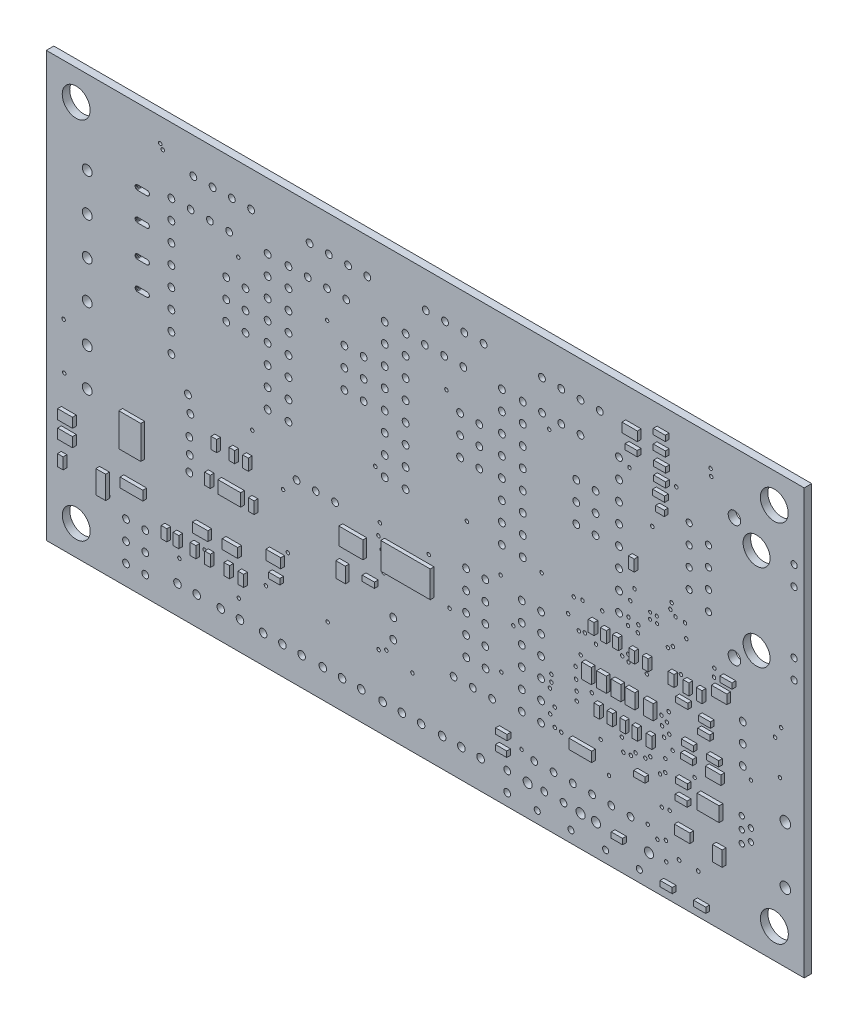
from build123d import *

# Parameters (mm, degrees)
SKETCH1_W           = 100
SKETCH1_H           = 56
SKETCH1_R           = 0.2286
SKETCH1_R_2         = 0.45
SKETCH1_R_3         = 0.2032
SKETCH1_R_4         = 0.4
SKETCH1_R_5         = 0.6
SKETCH1_R_6         = 1.778
SKETCH1_R_7         = 0.4064
SKETCH1_R_8         = 0.8255
SKETCH1_R_9         = 0.4445
SKETCH1_R_10        = 1.8415
SKETCH1_R_11        = 0.5
SKETCH1_R_12        = 0.65
SKETCH1_R_13        = 0.7
SKETCH1_R_14        = 0.35
SKETCH1_R_15        = 0.25
BOSS_EXTRUDE1_DEPTH = 0.991
SKETCH3_W           = 14.03
SKETCH3_H           = 14.03
BOSS_EXTRUDE2_DEPTH = 1.61
CHAMFER1_SIZE       = 0.61
CHAMFER2_SIZE       = 0.61
SKETCH4_W           = 1.304957509
SKETCH4_H           = 3.011808396
SKETCH4_W_2         = 0.747676452
SKETCH4_H_2         = 1.493492764
SKETCH4_W_3         = 1.967512926
SKETCH4_H_3         = 1.275000018
SKETCH4_H_4         = 1.275000015
SKETCH4_W_4         = 3.011798701
SKETCH4_H_5         = 1.246641716
SKETCH4_H_6         = 1.511746408
SKETCH4_W_5         = 0.747676453
SKETCH4_H_7         = 1.511746407
SKETCH4_W_6         = 0.765000025
SKETCH4_W_7         = 0.765000024
SKETCH4_H_8         = 1.493492763
SKETCH4_W_8         = 2.039999962
SKETCH4_H_9         = 1.246482293
SKETCH4_W_9         = 2.039999961
SKETCH4_W_10        = 1.967512925
SKETCH4_W_11        = 1.493492761
SKETCH4_H_10        = 0.74767645
SKETCH4_W_12        = 1.275000015
SKETCH4_H_11        = 2.015661876
SKETCH4_W_13        = 1.60649999
SKETCH4_H_12        = 0.726022008
SKETCH4_W_14        = 3.18
SKETCH4_H_13        = 2.28
SKETCH4_W_15        = 6.527994472
SKETCH4_H_14        = 3.518567085
SKETCH4_H_15        = 0.747676452
SKETCH4_W_16        = 1.511746405
SKETCH4_H_16        = 0.728187441
SKETCH4_W_17        = 1.587333678
SKETCH4_H_17        = 0.728187442
SKETCH4_W_18        = 1.587333679
SKETCH4_H_18        = 1.222102323
SKETCH4_H_19        = 1.222102324
SKETCH4_W_19        = 1.129246393
SKETCH4_H_20        = 0.726022005
SKETCH4_H_21        = 0.73035288
SKETCH4_W_20        = 1.275000018
SKETCH4_H_22        = 1.991323711
SKETCH4_W_21        = 2.91209749
SKETCH4_H_23        = 1.929775795
SKETCH4_W_22        = 1.275000016
SKETCH4_H_24        = 1.967512926
SKETCH4_H_25        = 1.967512925
SKETCH4_W_23        = 3.011808396
SKETCH4_H_26        = 1.304957507
SKETCH4_W_24        = 3.007851747
SKETCH4_H_27        = 1.656233035
SKETCH4_W_25        = 0.765000027
SKETCH4_H_28        = 1.568167369
SKETCH4_W_26        = 2.912100155
SKETCH4_H_29        = 4.346021334
BOSS_EXTRUDE3_DEPTH = 0.5


with BuildPart() as part:
    # Sketch1 → Boss-Extrude1 (new body)
    with BuildSketch(Plane.XY):
        with Locations((13.307133333, 19.688733333)):
            Rectangle(SKETCH1_W, SKETCH1_H)
        with Locations((16.517133333, 10.542066667)):
            Circle(SKETCH1_R, mode=Mode.SUBTRACT)
        with Locations((16.1038, 35.292066667)):
            Circle(SKETCH1_R, mode=Mode.SUBTRACT)
        with Locations((23.247133333, 17.708733333)):
            Circle(SKETCH1_R, mode=Mode.SUBTRACT)
        with Locations((28.654966667, 20.675)):
            Circle(SKETCH1_R, mode=Mode.SUBTRACT)
        with Locations((33.2873, 8.324)):
            Circle(SKETCH1_R, mode=Mode.SUBTRACT)
        with Locations((29.7584, 8.038833333)):
            Circle(SKETCH1_R, mode=Mode.SUBTRACT)
        with Locations((7.324866667, 15.717566667)):
            Circle(SKETCH1_R, mode=Mode.SUBTRACT)
        with Locations((0.357133333, 35.348733333)):
            Circle(SKETCH1_R, mode=Mode.SUBTRACT)
        with Locations((18.7985, 21.621333333)):
            Circle(SKETCH1_R, mode=Mode.SUBTRACT)
        with Locations((29.953666667, 9.716366667)):
            Circle(SKETCH1_R, mode=Mode.SUBTRACT)
        with Locations((29.957133333, 8.818733333)):
            Circle(SKETCH1_R, mode=Mode.SUBTRACT)
        with Locations((13.775033333, 15.313666667)):
            Circle(SKETCH1_R, mode=Mode.SUBTRACT)
        with Locations((-11.3662, 36.7154)):
            Circle(SKETCH1_R, mode=Mode.SUBTRACT)
        with Locations((-9.514866667, 17.868733333)):
            Circle(SKETCH1_R, mode=Mode.SUBTRACT)
        with Locations((31.240733333, 3.7565)):
            Circle(SKETCH1_R, mode=Mode.SUBTRACT)
        with Locations((23.347133333, 6.668733333)):
            Circle(SKETCH1_R, mode=Mode.SUBTRACT)
        with Locations((-4.822866667, 6.2254)):
            Circle(SKETCH1_R, mode=Mode.SUBTRACT)
        with Locations((-5.455866667, 13.126533333)):
            Circle(SKETCH1_R, mode=Mode.SUBTRACT)
        with Locations((44.280266667, 5.492133333)):
            Circle(SKETCH1_R, mode=Mode.SUBTRACT)
        with Locations((44.978, 6.005366667)):
            Circle(SKETCH1_R, mode=Mode.SUBTRACT)
        with Locations((44.4754, 12.311333333)):
            Circle(SKETCH1_R, mode=Mode.SUBTRACT)
        with Locations((43.267133333, 33.278733333)):
            Circle(SKETCH1_R, mode=Mode.SUBTRACT)
        with Locations((42.6598, -1.0665)):
            Circle(SKETCH1_R, mode=Mode.SUBTRACT)
        with Locations((34.367133333, 16.658733333)):
            Circle(SKETCH1_R, mode=Mode.SUBTRACT)
        with Locations((60.109233333, 12.993033333)):
            Circle(SKETCH1_R, mode=Mode.SUBTRACT)
        with Locations((34.054133333, 20.227433333)):
            Circle(SKETCH1_R, mode=Mode.SUBTRACT)
        with Locations((32.895666667, 20.0402)):
            Circle(SKETCH1_R, mode=Mode.SUBTRACT)
        with Locations((59.464766667, 17.276366667)):
            Circle(SKETCH1_R, mode=Mode.SUBTRACT)
        with Locations((35.836333333, 16.1019)):
            Circle(SKETCH1_R, mode=Mode.SUBTRACT)
        with Locations((45.058033333, -1.707333333)):
            Circle(SKETCH1_R, mode=Mode.SUBTRACT)
        with Locations((45.196033333, 11.876533333)):
            Circle(SKETCH1_R, mode=Mode.SUBTRACT)
        with Locations((45.497133333, 10.638733333)):
            Circle(SKETCH1_R, mode=Mode.SUBTRACT)
        with Locations((47.577133333, 24.406633333)):
            Circle(SKETCH1_R, mode=Mode.SUBTRACT)
        with Locations((45.942433333, 9.0166)):
            Circle(SKETCH1_R, mode=Mode.SUBTRACT)
        with Locations((7.1314, 14.127733333)):
            Circle(SKETCH1_R, mode=Mode.SUBTRACT)
        with Locations((8.1788, 1.5814)):
            Circle(SKETCH1_R, mode=Mode.SUBTRACT)
        with Locations((7.150466667, 1.132433333)):
            Circle(SKETCH1_R, mode=Mode.SUBTRACT)
        with Locations((7.560233333, 12.723533333)):
            Circle(SKETCH1_R, mode=Mode.SUBTRACT)
        with Locations((33.570733333, 16.4904)):
            Circle(SKETCH1_R, mode=Mode.SUBTRACT)
        with Locations((30.405466667, 3.868966667)):
            Circle(SKETCH1_R, mode=Mode.SUBTRACT)
        with Locations((33.817133333, 13.858733333)):
            Circle(SKETCH1_R, mode=Mode.SUBTRACT)
        with Locations((45.554133333, 1.960466667)):
            Circle(SKETCH1_R, mode=Mode.SUBTRACT)
        with Locations((44.522833333, 1.823566667)):
            Circle(SKETCH1_R, mode=Mode.SUBTRACT)
        with Locations((29.78, 5.116033333)):
            Circle(SKETCH1_R, mode=Mode.SUBTRACT)
        with Locations((35.280466667, 10.2754)):
            Circle(SKETCH1_R, mode=Mode.SUBTRACT)
        with Locations((33.137266667, 12.216166667)):
            Circle(SKETCH1_R, mode=Mode.SUBTRACT)
        with Locations((24.935866667, 12.76)):
            Circle(SKETCH1_R, mode=Mode.SUBTRACT)
        with Locations((44.9896, 7.609033333)):
            Circle(SKETCH1_R, mode=Mode.SUBTRACT)
        with Locations((36.447133333, 5.518733333)):
            Circle(SKETCH1_R, mode=Mode.SUBTRACT)
        with Locations((48.840466667, 7.3754)):
            Circle(SKETCH1_R, mode=Mode.SUBTRACT)
        with Locations((39.448433333, 5.549133333)):
            Circle(SKETCH1_R, mode=Mode.SUBTRACT)
        with Locations((40.437133333, 5.692066667)):
            Circle(SKETCH1_R, mode=Mode.SUBTRACT)
        with Locations((33.274433333, 9.458733333)):
            Circle(SKETCH1_R, mode=Mode.SUBTRACT)
        with Locations((33.2072, 10.780633333)):
            Circle(SKETCH1_R, mode=Mode.SUBTRACT)
        with Locations((-19.129533333, -1.5746)):
            Circle(SKETCH1_R, mode=Mode.SUBTRACT)
        with Locations((45.4266, 13.179366667)):
            Circle(SKETCH1_R, mode=Mode.SUBTRACT)
        with Locations((11.617133333, 0.7045)):
            Circle(SKETCH1_R, mode=Mode.SUBTRACT)
        with Locations((41.427133333, 21.1092)):
            Circle(SKETCH1_R, mode=Mode.SUBTRACT)
        with Locations((47.747133333, 22.678733333)):
            Circle(SKETCH1_R, mode=Mode.SUBTRACT)
        with Locations((40.917133333, 24.978733333)):
            Circle(SKETCH1_R, mode=Mode.SUBTRACT)
        with Locations((41.361033333, 20.165566667)):
            Circle(SKETCH1_R, mode=Mode.SUBTRACT)
        with Locations((46.427133333, 39.368733333)):
            Circle(SKETCH1_R, mode=Mode.SUBTRACT)
        with Locations((40.2556, 38.4838)):
            Circle(SKETCH1_R, mode=Mode.SUBTRACT)
        with Locations((40.357133333, 23.338733333)):
            Circle(SKETCH1_R, mode=Mode.SUBTRACT)
        with Locations((41.054133333, 6.2989)):
            Circle(SKETCH1_R, mode=Mode.SUBTRACT)
        with Locations((39.253133333, 7.182733333)):
            Circle(SKETCH1_R, mode=Mode.SUBTRACT)
        with Locations((42.338833333, 6.328733333)):
            Circle(SKETCH1_R, mode=Mode.SUBTRACT)
        with Locations((42.9945, 6.828033333)):
            Circle(SKETCH1_R, mode=Mode.SUBTRACT)
        with Locations((30.386433333, 6.186533333)):
            Circle(SKETCH1_R, mode=Mode.SUBTRACT)
        with Locations((-34.406866667, 18.111466667)):
            Circle(SKETCH1_R, mode=Mode.SUBTRACT)
        with Locations((-28.5043, 0.940866667)):
            Circle(SKETCH1_R, mode=Mode.SUBTRACT)
        with Locations((26.011566667, -0.8344)):
            Circle(SKETCH1_R, mode=Mode.SUBTRACT)
        with Locations((7.8107, 10.236633333)):
            Circle(SKETCH1_R, mode=Mode.SUBTRACT)
        with Locations((29.667133333, 37.558733333)):
            Circle(SKETCH1_R, mode=Mode.SUBTRACT)
        with Locations((45.657133333, 24.988733333)):
            Circle(SKETCH1_R, mode=Mode.SUBTRACT)
        with Locations((46.327133333, 24.488733333)):
            Circle(SKETCH1_R, mode=Mode.SUBTRACT)
        with Locations((45.807133333, 25.828733333)):
            Circle(SKETCH1_R, mode=Mode.SUBTRACT)
        with Locations((40.091166667, 17.0729)):
            Circle(SKETCH1_R, mode=Mode.SUBTRACT)
        with Locations((40.123066667, 16.205066667)):
            Circle(SKETCH1_R, mode=Mode.SUBTRACT)
        with Locations((40.120466667, 21.342066667)):
            Circle(SKETCH1_R, mode=Mode.SUBTRACT)
        with Locations((47.047133333, 18.238733333)):
            Circle(SKETCH1_R, mode=Mode.SUBTRACT)
        with Locations((51.4538, 21.1754)):
            Circle(SKETCH1_R, mode=Mode.SUBTRACT)
        with Locations((40.060466667, 20.342066667)):
            Circle(SKETCH1_R, mode=Mode.SUBTRACT)
        with Locations((36.657133333, 20.318733333)):
            Circle(SKETCH1_R, mode=Mode.SUBTRACT)
        with Locations((45.325533333, 20.4579)):
            Circle(SKETCH1_R, mode=Mode.SUBTRACT)
        with Locations((39.297133333, 16.488733333)):
            Circle(SKETCH1_R, mode=Mode.SUBTRACT)
        with Locations((45.987133333, 20.918733333)):
            Circle(SKETCH1_R, mode=Mode.SUBTRACT)
        with Locations((42.541533333, 16.037033333)):
            Circle(SKETCH1_R, mode=Mode.SUBTRACT)
        with Locations((-11.2929, -2.2113)):
            Circle(SKETCH1_R, mode=Mode.SUBTRACT)
        with Locations((32.157133333, 17.748733333)):
            Circle(SKETCH1_R, mode=Mode.SUBTRACT)
        with Locations((-15.7962, 1.048733333)):
            Circle(SKETCH1_R, mode=Mode.SUBTRACT)
        with Locations((45.107133333, -4.131266667)):
            Circle(SKETCH1_R, mode=Mode.SUBTRACT)
        with Locations((44.814766667, 9.958733333)):
            Circle(SKETCH1_R, mode=Mode.SUBTRACT)
        with Locations((0.4297, 0.934466667)):
            Circle(SKETCH1_R, mode=Mode.SUBTRACT)
        with Locations((43.940133333, -2.1493)):
            Circle(SKETCH1_R, mode=Mode.SUBTRACT)
        with Locations((51.4038, 20.1054)):
            Circle(SKETCH1_R, mode=Mode.SUBTRACT)
        with Locations((56.2838, 10.788733333)):
            Circle(SKETCH1_R, mode=Mode.SUBTRACT)
        with Locations((60.252366667, 18.778733333)):
            Circle(SKETCH1_R, mode=Mode.SUBTRACT)
        with Locations((44.5511, 11.129766667)):
            Circle(SKETCH1_R, mode=Mode.SUBTRACT)
        with Locations((-7.712866667, 1.008733333)):
            Circle(SKETCH1_R, mode=Mode.SUBTRACT)
        with Locations((6.717133333, 21.8554)):
            Circle(SKETCH1_R, mode=Mode.SUBTRACT)
        with Locations((37.554133333, 1.958466667)):
            Circle(SKETCH1_R, mode=Mode.SUBTRACT)
        with Locations((51.046, 42.863433333)):
            Circle(SKETCH1_R, mode=Mode.SUBTRACT)
        with Locations((50.954666667, 43.742866667)):
            Circle(SKETCH1_R, mode=Mode.SUBTRACT)
        with Locations((-21.327033333, 44.012166667)):
            Circle(SKETCH1_R, mode=Mode.SUBTRACT)
        with Locations((-21.664366667, 44.555966667)):
            Circle(SKETCH1_R, mode=Mode.SUBTRACT)
        with Locations((-34.329733333, 12.002933333)):
            Circle(SKETCH1_R, mode=Mode.SUBTRACT)
        with Locations((-9.669533333, 43.021366667)):
            Circle(SKETCH1_R_2, mode=Mode.SUBTRACT)
        with Locations((-12.209533333, 43.021366667)):
            Circle(SKETCH1_R_2, mode=Mode.SUBTRACT)
        with Locations((-14.749533333, 43.016733333)):
            Circle(SKETCH1_R_2, mode=Mode.SUBTRACT)
        with Locations((-17.289533333, 43.012066667)):
            Circle(SKETCH1_R_2, mode=Mode.SUBTRACT)
        with Locations((5.667133333, 43.031366667)):
            Circle(SKETCH1_R_2, mode=Mode.SUBTRACT)
        with Locations((3.127133333, 43.031366667)):
            Circle(SKETCH1_R_2, mode=Mode.SUBTRACT)
        with Locations((0.587133333, 43.026733333)):
            Circle(SKETCH1_R_2, mode=Mode.SUBTRACT)
        with Locations((-1.952866667, 43.022066667)):
            Circle(SKETCH1_R_2, mode=Mode.SUBTRACT)
        with Locations((21.0038, 43.021366667)):
            Circle(SKETCH1_R_2, mode=Mode.SUBTRACT)
        with Locations((18.4638, 43.021366667)):
            Circle(SKETCH1_R_2, mode=Mode.SUBTRACT)
        with Locations((15.9238, 43.016733333)):
            Circle(SKETCH1_R_2, mode=Mode.SUBTRACT)
        with Locations((13.3838, 43.012066667)):
            Circle(SKETCH1_R_2, mode=Mode.SUBTRACT)
        with Locations((36.3338, 43.001366667)):
            Circle(SKETCH1_R_2, mode=Mode.SUBTRACT)
        with Locations((33.7938, 43.001366667)):
            Circle(SKETCH1_R_2, mode=Mode.SUBTRACT)
        with Locations((31.2538, 42.996733333)):
            Circle(SKETCH1_R_2, mode=Mode.SUBTRACT)
        with Locations((28.7138, 42.992066667)):
            Circle(SKETCH1_R_2, mode=Mode.SUBTRACT)
        with Locations((42.977133333, 22.508733333)):
            Circle(SKETCH1_R_3, mode=Mode.SUBTRACT)
        with Locations((43.888866667, 22.474)):
            Circle(SKETCH1_R_3, mode=Mode.SUBTRACT)
        with Locations((43.854133333, 23.324933333)):
            Circle(SKETCH1_R_3, mode=Mode.SUBTRACT)
        with Locations((42.985833333, 23.324933333)):
            Circle(SKETCH1_R_3, mode=Mode.SUBTRACT)
        with Locations((32.531166667, -6.787266667)):
            Circle(SKETCH1_R_4, mode=Mode.SUBTRACT)
        with Locations((28.086166667, -6.787266667)):
            Circle(SKETCH1_R_4, mode=Mode.SUBTRACT)
        with Locations((33.801166667, -4.247266667)):
            Circle(SKETCH1_R_5, mode=Mode.SUBTRACT)
        with Locations((26.816166667, -4.247266667)):
            Circle(SKETCH1_R_5, mode=Mode.SUBTRACT)
        with Locations((57.024133333, 37.387733333)):
            Circle(SKETCH1_R_6, mode=Mode.SUBTRACT)
        with Locations((57.024133333, 25.957733333)):
            Circle(SKETCH1_R_6, mode=Mode.SUBTRACT)
        with Locations((61.977133333, 35.736733333)):
            Circle(SKETCH1_R_7, mode=Mode.SUBTRACT)
        with Locations((61.977133333, 38.276733333)):
            Circle(SKETCH1_R_7, mode=Mode.SUBTRACT)
        with Locations((48.134133333, 28.497733333)):
            Circle(SKETCH1_R_7, mode=Mode.SUBTRACT)
        with Locations((50.674133333, 27.227733333)):
            Circle(SKETCH1_R_7, mode=Mode.SUBTRACT)
        with Locations((54.103133333, 23.671733333)):
            Circle(SKETCH1_R_8, mode=Mode.SUBTRACT)
        with Locations((54.103133333, 39.673733333)):
            Circle(SKETCH1_R_8, mode=Mode.SUBTRACT)
        with Locations((48.134133333, 33.577733333)):
            Circle(SKETCH1_R_7, mode=Mode.SUBTRACT)
        with Locations((50.674133333, 29.767733333)):
            Circle(SKETCH1_R_7, mode=Mode.SUBTRACT)
        with Locations((50.674133333, 32.307733333)):
            Circle(SKETCH1_R_7, mode=Mode.SUBTRACT)
        with Locations((48.134133333, 31.037733333)):
            Circle(SKETCH1_R_7, mode=Mode.SUBTRACT)
        with Locations((50.674133333, 34.847733333)):
            Circle(SKETCH1_R_7, mode=Mode.SUBTRACT)
        with Locations((48.134133333, 36.117733333)):
            Circle(SKETCH1_R_7, mode=Mode.SUBTRACT)
        with Locations((61.977133333, 27.608733333)):
            Circle(SKETCH1_R_7, mode=Mode.SUBTRACT)
        with Locations((61.977133333, 25.068733333)):
            Circle(SKETCH1_R_7, mode=Mode.SUBTRACT)
        with Locations((9.088633333, 3.244966667)):
            Circle(SKETCH1_R_9, mode=Mode.SUBTRACT)
        with Locations((9.088633333, 5.784966667)):
            Circle(SKETCH1_R_9, mode=Mode.SUBTRACT)
        with Locations((21.269933333, 6.039733333)):
            Circle(SKETCH1_R_9, mode=Mode.SUBTRACT)
        with Locations((18.729933333, 6.039733333)):
            Circle(SKETCH1_R_9, mode=Mode.SUBTRACT)
        with Locations((41.5524, -6.778766667)):
            Circle(SKETCH1_R_4, mode=Mode.SUBTRACT)
        with Locations((37.1074, -6.778766667)):
            Circle(SKETCH1_R_4, mode=Mode.SUBTRACT)
        with Locations((42.8224, -4.238766667)):
            Circle(SKETCH1_R_5, mode=Mode.SUBTRACT)
        with Locations((35.8374, -4.238766667)):
            Circle(SKETCH1_R_5, mode=Mode.SUBTRACT)
        with Locations((59.3696, -4.380766667)):
            Circle(SKETCH1_R_10, mode=Mode.SUBTRACT)
        with Locations((59.360433333, 43.742233333)):
            Circle(SKETCH1_R_10, mode=Mode.SUBTRACT)
        with Locations((-32.7488, 43.734533333)):
            Circle(SKETCH1_R_10, mode=Mode.SUBTRACT)
        with Locations((-32.740366667, -4.374766667)):
            Circle(SKETCH1_R_10, mode=Mode.SUBTRACT)
        with Locations((-17.819533333, 12.9654)):
            Circle(SKETCH1_R_2, mode=Mode.SUBTRACT)
        with Locations((-17.818433333, 8.893166667)):
            Circle(SKETCH1_R_2, mode=Mode.SUBTRACT)
        with Locations((-17.762866667, 10.928733333)):
            Circle(SKETCH1_R_2, mode=Mode.SUBTRACT)
        with Locations((-17.682066667, 15.652966667)):
            Circle(SKETCH1_R_2, mode=Mode.SUBTRACT)
        with Locations((-18.002866667, 17.718733333)):
            Circle(SKETCH1_R_2, mode=Mode.SUBTRACT)
        with Locations((33.7912, 38.9854)):
            Circle(SKETCH1_R_9, mode=Mode.SUBTRACT)
        with Locations((31.2512, 38.9854)):
            Circle(SKETCH1_R_9, mode=Mode.SUBTRACT)
        with Locations((28.7112, 38.9854)):
            Circle(SKETCH1_R_9, mode=Mode.SUBTRACT)
        with Locations((26.1712, 21.2054)):
            Circle(SKETCH1_R_2, mode=Mode.SUBTRACT)
        with Locations((26.1712, 36.4454)):
            Circle(SKETCH1_R_2, mode=Mode.SUBTRACT)
        with Locations((38.8712, 36.4454)):
            Circle(SKETCH1_R_2, mode=Mode.SUBTRACT)
        with Locations((38.8712, 33.9054)):
            Circle(SKETCH1_R_2, mode=Mode.SUBTRACT)
        with Locations((38.8712, 31.3654)):
            Circle(SKETCH1_R_2, mode=Mode.SUBTRACT)
        with Locations((38.8712, 28.8254)):
            Circle(SKETCH1_R_2, mode=Mode.SUBTRACT)
        with Locations((38.8712, 26.2854)):
            Circle(SKETCH1_R_2, mode=Mode.SUBTRACT)
        with Locations((38.8712, 23.7454)):
            Circle(SKETCH1_R_2, mode=Mode.SUBTRACT)
        with Locations((26.1712, 23.7454)):
            Circle(SKETCH1_R_2, mode=Mode.SUBTRACT)
        with Locations((26.1712, 38.9854)):
            Circle(SKETCH1_R_2, mode=Mode.SUBTRACT)
        with Locations((38.8712, 21.2054)):
            Circle(SKETCH1_R_2, mode=Mode.SUBTRACT)
        with Locations((38.8712, 38.9854)):
            Circle(SKETCH1_R_2, mode=Mode.SUBTRACT)
        with Locations((26.1712, 26.2854)):
            Circle(SKETCH1_R_2, mode=Mode.SUBTRACT)
        with Locations((26.1712, 28.8254)):
            Circle(SKETCH1_R_2, mode=Mode.SUBTRACT)
        with Locations((26.1712, 33.9054)):
            Circle(SKETCH1_R_2, mode=Mode.SUBTRACT)
        with Locations((26.1712, 31.3654)):
            Circle(SKETCH1_R_2, mode=Mode.SUBTRACT)
        with Locations((18.337133333, 39.0254)):
            Circle(SKETCH1_R_9, mode=Mode.SUBTRACT)
        with Locations((15.797133333, 39.0254)):
            Circle(SKETCH1_R_9, mode=Mode.SUBTRACT)
        with Locations((13.257133333, 39.0254)):
            Circle(SKETCH1_R_9, mode=Mode.SUBTRACT)
        with Locations((10.717133333, 21.2454)):
            Circle(SKETCH1_R_2, mode=Mode.SUBTRACT)
        with Locations((10.717133333, 36.4854)):
            Circle(SKETCH1_R_2, mode=Mode.SUBTRACT)
        with Locations((23.417133333, 36.4854)):
            Circle(SKETCH1_R_2, mode=Mode.SUBTRACT)
        with Locations((23.417133333, 33.9454)):
            Circle(SKETCH1_R_2, mode=Mode.SUBTRACT)
        with Locations((23.417133333, 31.4054)):
            Circle(SKETCH1_R_2, mode=Mode.SUBTRACT)
        with Locations((23.417133333, 28.8654)):
            Circle(SKETCH1_R_2, mode=Mode.SUBTRACT)
        with Locations((23.417133333, 26.3254)):
            Circle(SKETCH1_R_2, mode=Mode.SUBTRACT)
        with Locations((23.417133333, 23.7854)):
            Circle(SKETCH1_R_2, mode=Mode.SUBTRACT)
        with Locations((10.717133333, 23.7854)):
            Circle(SKETCH1_R_2, mode=Mode.SUBTRACT)
        with Locations((10.717133333, 39.0254)):
            Circle(SKETCH1_R_2, mode=Mode.SUBTRACT)
        with Locations((23.417133333, 21.2454)):
            Circle(SKETCH1_R_2, mode=Mode.SUBTRACT)
        with Locations((23.417133333, 39.0254)):
            Circle(SKETCH1_R_2, mode=Mode.SUBTRACT)
        with Locations((10.717133333, 26.3254)):
            Circle(SKETCH1_R_2, mode=Mode.SUBTRACT)
        with Locations((10.717133333, 28.8654)):
            Circle(SKETCH1_R_2, mode=Mode.SUBTRACT)
        with Locations((10.717133333, 33.9454)):
            Circle(SKETCH1_R_2, mode=Mode.SUBTRACT)
        with Locations((10.717133333, 31.4054)):
            Circle(SKETCH1_R_2, mode=Mode.SUBTRACT)
        with Locations((2.8838, 39.0154)):
            Circle(SKETCH1_R_9, mode=Mode.SUBTRACT)
        with Locations((0.3438, 39.0154)):
            Circle(SKETCH1_R_9, mode=Mode.SUBTRACT)
        with Locations((-2.1962, 39.0154)):
            Circle(SKETCH1_R_9, mode=Mode.SUBTRACT)
        with Locations((-4.7362, 21.2354)):
            Circle(SKETCH1_R_2, mode=Mode.SUBTRACT)
        with Locations((-4.7362, 36.4754)):
            Circle(SKETCH1_R_2, mode=Mode.SUBTRACT)
        with Locations((7.9638, 36.4754)):
            Circle(SKETCH1_R_2, mode=Mode.SUBTRACT)
        with Locations((7.9638, 33.9354)):
            Circle(SKETCH1_R_2, mode=Mode.SUBTRACT)
        with Locations((7.9638, 31.3954)):
            Circle(SKETCH1_R_2, mode=Mode.SUBTRACT)
        with Locations((7.9638, 28.8554)):
            Circle(SKETCH1_R_2, mode=Mode.SUBTRACT)
        with Locations((7.9638, 26.3154)):
            Circle(SKETCH1_R_2, mode=Mode.SUBTRACT)
        with Locations((7.9638, 23.7754)):
            Circle(SKETCH1_R_2, mode=Mode.SUBTRACT)
        with Locations((-4.7362, 23.7754)):
            Circle(SKETCH1_R_2, mode=Mode.SUBTRACT)
        with Locations((-4.7362, 39.0154)):
            Circle(SKETCH1_R_2, mode=Mode.SUBTRACT)
        with Locations((7.9638, 21.2354)):
            Circle(SKETCH1_R_2, mode=Mode.SUBTRACT)
        with Locations((7.9638, 39.0154)):
            Circle(SKETCH1_R_2, mode=Mode.SUBTRACT)
        with Locations((-4.7362, 26.3154)):
            Circle(SKETCH1_R_2, mode=Mode.SUBTRACT)
        with Locations((-4.7362, 28.8554)):
            Circle(SKETCH1_R_2, mode=Mode.SUBTRACT)
        with Locations((-4.7362, 33.9354)):
            Circle(SKETCH1_R_2, mode=Mode.SUBTRACT)
        with Locations((-4.7362, 31.3954)):
            Circle(SKETCH1_R_2, mode=Mode.SUBTRACT)
        with Locations((-12.569533333, 39.0254)):
            Circle(SKETCH1_R_9, mode=Mode.SUBTRACT)
        with Locations((-15.109533333, 39.0254)):
            Circle(SKETCH1_R_9, mode=Mode.SUBTRACT)
        with Locations((-17.649533333, 39.0254)):
            Circle(SKETCH1_R_9, mode=Mode.SUBTRACT)
        with Locations((-20.189533333, 21.2454)):
            Circle(SKETCH1_R_2, mode=Mode.SUBTRACT)
        with Locations((-20.189533333, 36.4854)):
            Circle(SKETCH1_R_2, mode=Mode.SUBTRACT)
        with Locations((-7.489533333, 36.4854)):
            Circle(SKETCH1_R_2, mode=Mode.SUBTRACT)
        with Locations((-7.489533333, 33.9454)):
            Circle(SKETCH1_R_2, mode=Mode.SUBTRACT)
        with Locations((-7.489533333, 31.4054)):
            Circle(SKETCH1_R_2, mode=Mode.SUBTRACT)
        with Locations((-7.489533333, 28.8654)):
            Circle(SKETCH1_R_2, mode=Mode.SUBTRACT)
        with Locations((-7.489533333, 26.3254)):
            Circle(SKETCH1_R_2, mode=Mode.SUBTRACT)
        with Locations((-7.489533333, 23.7854)):
            Circle(SKETCH1_R_2, mode=Mode.SUBTRACT)
        with Locations((-20.189533333, 23.7854)):
            Circle(SKETCH1_R_2, mode=Mode.SUBTRACT)
        with Locations((-20.189533333, 39.0254)):
            Circle(SKETCH1_R_2, mode=Mode.SUBTRACT)
        with Locations((-7.489533333, 21.2454)):
            Circle(SKETCH1_R_2, mode=Mode.SUBTRACT)
        with Locations((-7.489533333, 39.0254)):
            Circle(SKETCH1_R_2, mode=Mode.SUBTRACT)
        with Locations((-20.189533333, 26.3254)):
            Circle(SKETCH1_R_2, mode=Mode.SUBTRACT)
        with Locations((-20.189533333, 28.8654)):
            Circle(SKETCH1_R_2, mode=Mode.SUBTRACT)
        with Locations((-20.189533333, 33.9454)):
            Circle(SKETCH1_R_2, mode=Mode.SUBTRACT)
        with Locations((-20.189533333, 31.4054)):
            Circle(SKETCH1_R_2, mode=Mode.SUBTRACT)
        with Locations((55.197133333, 16.9454)):
            Circle(SKETCH1_R_9, mode=Mode.SUBTRACT)
        with Locations((55.197133333, 14.4054)):
            Circle(SKETCH1_R_9, mode=Mode.SUBTRACT)
        with Locations((55.197133333, 11.8654)):
            Circle(SKETCH1_R_9, mode=Mode.SUBTRACT)
        with Locations((-13.6768, -4.579166667)):
            Circle(SKETCH1_R_11, mode=Mode.SUBTRACT)
        with Locations((-11.1368, -4.5745)):
            Circle(SKETCH1_R_11, mode=Mode.SUBTRACT)
        with Locations((-19.384666667, -4.579166667)):
            Circle(SKETCH1_R_11, mode=Mode.SUBTRACT)
        with Locations((-16.844666667, -4.5745)):
            Circle(SKETCH1_R_11, mode=Mode.SUBTRACT)
        with Locations((-3.672866667, 15.0986)):
            Circle(SKETCH1_R_9, mode=Mode.SUBTRACT)
        with Locations((-1.132866667, 15.0986)):
            Circle(SKETCH1_R_9, mode=Mode.SUBTRACT)
        with Locations((1.407133333, 15.0986)):
            Circle(SKETCH1_R_9, mode=Mode.SUBTRACT)
        with Locations((22.125833333, 3.001733333)):
            Circle(SKETCH1_R_9, mode=Mode.SUBTRACT)
        with Locations((19.585833333, 3.001733333)):
            Circle(SKETCH1_R_9, mode=Mode.SUBTRACT)
        with Locations((17.045833333, 3.001733333)):
            Circle(SKETCH1_R_9, mode=Mode.SUBTRACT)
        with Locations((15.531666667, -4.549433333)):
            Circle(SKETCH1_R_11, mode=Mode.SUBTRACT)
        with Locations((18.071666667, -4.5448)):
            Circle(SKETCH1_R_11, mode=Mode.SUBTRACT)
        with Locations((20.6117, -4.540133333)):
            Circle(SKETCH1_R_11, mode=Mode.SUBTRACT)
        with Locations((7.678066667, -4.549433333)):
            Circle(SKETCH1_R_11, mode=Mode.SUBTRACT)
        with Locations((10.218066667, -4.5448)):
            Circle(SKETCH1_R_11, mode=Mode.SUBTRACT)
        with Locations((12.7581, -4.540133333)):
            Circle(SKETCH1_R_11, mode=Mode.SUBTRACT)
        with Locations((-0.2119, -4.549433333)):
            Circle(SKETCH1_R_11, mode=Mode.SUBTRACT)
        with Locations((2.3281, -4.5448)):
            Circle(SKETCH1_R_11, mode=Mode.SUBTRACT)
        with Locations((4.868133333, -4.540133333)):
            Circle(SKETCH1_R_11, mode=Mode.SUBTRACT)
        with Locations((-8.0837, -4.585833333)):
            Circle(SKETCH1_R_11, mode=Mode.SUBTRACT)
        with Locations((-5.5437, -4.5812)):
            Circle(SKETCH1_R_11, mode=Mode.SUBTRACT)
        with Locations((-3.003666667, -4.576533333)):
            Circle(SKETCH1_R_11, mode=Mode.SUBTRACT)
        with Locations((-12.9462, 28.562066667)):
            Circle(SKETCH1_R_9, mode=Mode.SUBTRACT)
        with Locations((-12.9462, 31.102066667)):
            Circle(SKETCH1_R_9, mode=Mode.SUBTRACT)
        with Locations((-12.9462, 33.642066667)):
            Circle(SKETCH1_R_9, mode=Mode.SUBTRACT)
        with Locations((-10.4062, 28.562066667)):
            Circle(SKETCH1_R_9, mode=Mode.SUBTRACT)
        with Locations((-10.4062, 31.102066667)):
            Circle(SKETCH1_R_9, mode=Mode.SUBTRACT)
        with Locations((-10.4062, 33.642066667)):
            Circle(SKETCH1_R_9, mode=Mode.SUBTRACT)
        with Locations((2.640466667, 28.5454)):
            Circle(SKETCH1_R_9, mode=Mode.SUBTRACT)
        with Locations((2.640466667, 31.0854)):
            Circle(SKETCH1_R_9, mode=Mode.SUBTRACT)
        with Locations((2.640466667, 33.6254)):
            Circle(SKETCH1_R_9, mode=Mode.SUBTRACT)
        with Locations((5.180466667, 28.5454)):
            Circle(SKETCH1_R_9, mode=Mode.SUBTRACT)
        with Locations((5.180466667, 31.0854)):
            Circle(SKETCH1_R_9, mode=Mode.SUBTRACT)
        with Locations((5.180466667, 33.6254)):
            Circle(SKETCH1_R_9, mode=Mode.SUBTRACT)
        with Locations((17.899733333, 28.467933333)):
            Circle(SKETCH1_R_9, mode=Mode.SUBTRACT)
        with Locations((17.899733333, 31.007933333)):
            Circle(SKETCH1_R_9, mode=Mode.SUBTRACT)
        with Locations((17.899733333, 33.547933333)):
            Circle(SKETCH1_R_9, mode=Mode.SUBTRACT)
        with Locations((20.439733333, 28.467933333)):
            Circle(SKETCH1_R_9, mode=Mode.SUBTRACT)
        with Locations((20.439733333, 31.007933333)):
            Circle(SKETCH1_R_9, mode=Mode.SUBTRACT)
        with Locations((20.439733333, 33.547933333)):
            Circle(SKETCH1_R_9, mode=Mode.SUBTRACT)
        with Locations((33.238933333, 28.508733333)):
            Circle(SKETCH1_R_9, mode=Mode.SUBTRACT)
        with Locations((33.238933333, 31.048733333)):
            Circle(SKETCH1_R_9, mode=Mode.SUBTRACT)
        with Locations((33.238933333, 33.588733333)):
            Circle(SKETCH1_R_9, mode=Mode.SUBTRACT)
        with Locations((35.778933333, 28.508733333)):
            Circle(SKETCH1_R_9, mode=Mode.SUBTRACT)
        with Locations((35.778933333, 31.048733333)):
            Circle(SKETCH1_R_9, mode=Mode.SUBTRACT)
        with Locations((35.778933333, 33.588733333)):
            Circle(SKETCH1_R_9, mode=Mode.SUBTRACT)
        with Locations((24.1205, -6.733933333)):
            Circle(SKETCH1_R_9, mode=Mode.SUBTRACT)
        with Locations((24.1205, -4.193933333)):
            Circle(SKETCH1_R_9, mode=Mode.SUBTRACT)
        with Locations((27.696133333, -1.326266667)):
            Circle(SKETCH1_R_9, mode=Mode.SUBTRACT)
        with Locations((30.236133333, -1.326266667)):
            Circle(SKETCH1_R_9, mode=Mode.SUBTRACT)
        with Locations((32.776133333, -1.326266667)):
            Circle(SKETCH1_R_9, mode=Mode.SUBTRACT)
        with Locations((35.316133333, -1.326266667)):
            Circle(SKETCH1_R_9, mode=Mode.SUBTRACT)
        with Locations((37.856133333, -1.326266667)):
            Circle(SKETCH1_R_9, mode=Mode.SUBTRACT)
        with Locations((40.396133333, -1.326266667)):
            Circle(SKETCH1_R_9, mode=Mode.SUBTRACT)
        with Locations((-31.292866667, 11.688733333)):
            Circle(SKETCH1_R_12, mode=Mode.SUBTRACT)
        with Locations((-31.292866667, 16.688733333)):
            Circle(SKETCH1_R_12, mode=Mode.SUBTRACT)
        with Locations((-31.292866667, 21.688733333)):
            Circle(SKETCH1_R_12, mode=Mode.SUBTRACT)
        with Locations((-31.292866667, 26.688733333)):
            Circle(SKETCH1_R_12, mode=Mode.SUBTRACT)
        with Locations((-31.292866667, 31.688733333)):
            Circle(SKETCH1_R_12, mode=Mode.SUBTRACT)
        with Locations((-31.292866667, 36.688733333)):
            Circle(SKETCH1_R_12, mode=Mode.SUBTRACT)
        with Locations((60.8153, 8.2611)):
            Circle(SKETCH1_R_13, mode=Mode.SUBTRACT)
        with Locations((60.8153, 0.756366667)):
            Circle(SKETCH1_R_13, mode=Mode.SUBTRACT)
        with Locations((56.267133333, 5.308733333)):
            Circle(SKETCH1_R_14, mode=Mode.SUBTRACT)
        with Locations((56.267133333, 3.708733333)):
            Circle(SKETCH1_R_14, mode=Mode.SUBTRACT)
        with Locations((55.067133333, 6.108733333)):
            Circle(SKETCH1_R_14, mode=Mode.SUBTRACT)
        with Locations((55.067133333, 2.908733333)):
            Circle(SKETCH1_R_14, mode=Mode.SUBTRACT)
        with Locations((55.067133333, 4.508733333)):
            Circle(SKETCH1_R_14, mode=Mode.SUBTRACT)
        with Locations((28.585133333, 16.199733333)):
            Circle(SKETCH1_R_9, mode=Mode.SUBTRACT)
        with Locations((28.585133333, 13.659733333)):
            Circle(SKETCH1_R_9, mode=Mode.SUBTRACT)
        with Locations((28.585133333, 11.119733333)):
            Circle(SKETCH1_R_9, mode=Mode.SUBTRACT)
        with Locations((26.045133333, 16.199733333)):
            Circle(SKETCH1_R_9, mode=Mode.SUBTRACT)
        with Locations((26.045133333, 13.659733333)):
            Circle(SKETCH1_R_9, mode=Mode.SUBTRACT)
        with Locations((26.045133333, 11.119733333)):
            Circle(SKETCH1_R_9, mode=Mode.SUBTRACT)
        with Locations((-23.6384, -0.606133333)):
            Circle(SKETCH1_R_9, mode=Mode.SUBTRACT)
        with Locations((-23.6384, -3.146133333)):
            Circle(SKETCH1_R_9, mode=Mode.SUBTRACT)
        with Locations((-23.6384, -5.686133333)):
            Circle(SKETCH1_R_9, mode=Mode.SUBTRACT)
        with Locations((-26.1784, -0.606133333)):
            Circle(SKETCH1_R_9, mode=Mode.SUBTRACT)
        with Locations((-26.1784, -3.146133333)):
            Circle(SKETCH1_R_9, mode=Mode.SUBTRACT)
        with Locations((-26.1784, -5.686133333)):
            Circle(SKETCH1_R_9, mode=Mode.SUBTRACT)
        with Locations((28.585133333, 8.579733333)):
            Circle(SKETCH1_R_9, mode=Mode.SUBTRACT)
        with Locations((28.585133333, 6.039733333)):
            Circle(SKETCH1_R_9, mode=Mode.SUBTRACT)
        with Locations((28.585133333, 3.499733333)):
            Circle(SKETCH1_R_9, mode=Mode.SUBTRACT)
        with Locations((26.045133333, 8.579733333)):
            Circle(SKETCH1_R_9, mode=Mode.SUBTRACT)
        with Locations((26.045133333, 6.039733333)):
            Circle(SKETCH1_R_9, mode=Mode.SUBTRACT)
        with Locations((26.045133333, 3.499733333)):
            Circle(SKETCH1_R_9, mode=Mode.SUBTRACT)
        with Locations((18.694866667, 11.117866667)):
            Circle(SKETCH1_R_9, mode=Mode.SUBTRACT)
        with Locations((18.694866667, 13.657866667)):
            Circle(SKETCH1_R_9, mode=Mode.SUBTRACT)
        with Locations((18.694866667, 16.197866667)):
            Circle(SKETCH1_R_9, mode=Mode.SUBTRACT)
        with Locations((21.234866667, 11.117866667)):
            Circle(SKETCH1_R_9, mode=Mode.SUBTRACT)
        with Locations((21.234866667, 13.657866667)):
            Circle(SKETCH1_R_9, mode=Mode.SUBTRACT)
        with Locations((21.234866667, 16.197866667)):
            Circle(SKETCH1_R_9, mode=Mode.SUBTRACT)
        with Locations((21.234866667, 8.577866667)):
            Circle(SKETCH1_R_9, mode=Mode.SUBTRACT)
        with Locations((18.694866667, 8.577866667)):
            Circle(SKETCH1_R_9, mode=Mode.SUBTRACT)
        with Locations((31.5511, -4.145566667)):
            Circle(SKETCH1_R_9, mode=Mode.SUBTRACT)
        with Locations((29.0111, -4.145566667)):
            Circle(SKETCH1_R_9, mode=Mode.SUBTRACT)
        with Locations((46.796033334, -3.078433333)):
            Circle(SKETCH1_R_15, mode=Mode.SUBTRACT)
        with Locations((49.3193, -3.080266667)):
            Circle(SKETCH1_R_15, mode=Mode.SUBTRACT)
        Polygon((-23.29471012, 26.123533232), (-23.405866667, 26.103933333), (-24.655866667, 26.103933333), (-24.767023213, 26.123533232), (-24.86477264, 26.179968889), (-24.937324923, 26.266433333), (-24.975929186, 26.372497676), (-24.975929186, 26.485368991), (-24.937324923, 26.591433333), (-24.86477264, 26.677897777), (-24.767023213, 26.734333435), (-24.655866667, 26.753933333), (-23.29471012, 26.734333435), (-23.196960694, 26.677897777), (-23.12440841, 26.591433333), (-23.085804147, 26.485368991), (-23.085804147, 26.372497676), (-23.12440841, 26.266433333), (-23.196960694, 26.179968889), align=None, mode=Mode.SUBTRACT)
        Polygon((-23.29471012, 29.831933232), (-23.405866667, 29.812333333), (-24.655866667, 29.812333333), (-24.767023213, 29.831933232), (-24.86477264, 29.888368889), (-24.937324923, 29.974833333), (-24.975929186, 30.080897676), (-24.975929186, 30.193768991), (-24.937324923, 30.299833333), (-24.86477264, 30.386297777), (-24.767023213, 30.442733435), (-24.655866667, 30.462333333), (-23.29471012, 30.442733435), (-23.196960694, 30.386297777), (-23.12440841, 30.299833333), (-23.085804147, 30.193768991), (-23.085804147, 30.080897676), (-23.12440841, 29.974833333), (-23.196960694, 29.888368889), align=None, mode=Mode.SUBTRACT)
        Polygon((-23.29471012, 34.022933232), (-23.405866667, 34.003333333), (-24.655866667, 34.003333333), (-24.767023213, 34.022933232), (-24.86477264, 34.079368889), (-24.937324923, 34.165833333), (-24.975929186, 34.271897676), (-24.975929186, 34.384768991), (-24.937324923, 34.490833333), (-24.86477264, 34.577297777), (-24.767023213, 34.633733435), (-24.655866667, 34.653333333), (-23.29471012, 34.633733435), (-23.196960694, 34.577297777), (-23.12440841, 34.490833333), (-23.085804147, 34.384768991), (-23.085804147, 34.271897676), (-23.12440841, 34.165833333), (-23.196960694, 34.079368889), align=None, mode=Mode.SUBTRACT)
        Polygon((-23.29471012, 37.731333232), (-23.405866667, 37.711733333), (-24.655866667, 37.711733333), (-24.767023213, 37.731333232), (-24.86477264, 37.787768889), (-24.937324923, 37.874233333), (-24.975929186, 37.980297676), (-24.975929186, 38.093168991), (-24.937324923, 38.199233333), (-24.86477264, 38.285697777), (-24.767023213, 38.342133435), (-24.655866667, 38.361733333), (-23.29471012, 38.342133435), (-23.196960694, 38.285697777), (-23.12440841, 38.199233333), (-23.085804147, 38.093168991), (-23.085804147, 37.980297676), (-23.12440841, 37.874233333), (-23.196960694, 37.787768889), align=None, mode=Mode.SUBTRACT)
    extrude(amount=-BOSS_EXTRUDE1_DEPTH)

    # Sketch3 → Boss-Extrude2 (add)
    with BuildSketch(Plane(origin=(0, 0, -0.991), x_dir=(-1, 0, 0), z_dir=(0, 0, -1))):
        with Locations((-39.552133333, 10.953733333)):
            Rectangle(SKETCH3_W, SKETCH3_H)
    extrude(amount=BOSS_EXTRUDE2_DEPTH)

    # Chamfer1
    chamfer1_edges = [part.edges().sort_by_distance(p)[0] for p in [
        (32.537133333, 3.938733333, -1.796),
        (32.537133333, 17.968733333, -1.796),
        (46.567133333, 17.968733333, -1.796),
        (46.567133333, 3.938733333, -1.796),
    ]]
    chamfer(chamfer1_edges, length=CHAMFER1_SIZE)

    # Chamfer2
    chamfer2_edges = [part.edges().sort_by_distance(p)[0] for p in [
        (46.262133333, 4.243733333, -2.601),
        (46.567133333, 10.953733333, -2.601),
        (46.262133333, 17.663733333, -2.601),
        (39.552133333, 17.968733333, -2.601),
        (32.842133333, 17.663733333, -2.601),
        (32.537133333, 10.953733333, -2.601),
        (32.842133333, 4.243733333, -2.601),
        (39.552133333, 3.938733333, -2.601),
    ]]
    chamfer(chamfer2_edges, length=CHAMFER2_SIZE)

    # Sketch4 → Boss-Extrude3 (add)
    with BuildSketch(Plane.XY):
        with Locations((-29.013072917, 2.160349322)):
            Rectangle(SKETCH4_W, SKETCH4_H)
        with Locations((-34.343028453, 2.102133332)):
            Rectangle(SKETCH4_W_2, SKETCH4_H_2)
        with Locations((-33.719541666, 5.137699999)):
            Rectangle(SKETCH4_W_3, SKETCH4_H_3)
        with Locations((-33.719541666, 7.356366666)):
            Rectangle(SKETCH4_W_3, SKETCH4_H_4)
        with Locations((-24.959055525, 3.674748353)):
            Rectangle(SKETCH4_W_4, SKETCH4_H_5)
        with Locations((-20.660871545, 0.725260155)):
            Rectangle(SKETCH4_W_2, SKETCH4_H_6)
        with Locations((-19.088195119, 0.728593488)):
            Rectangle(SKETCH4_W_5, SKETCH4_H_6)
        with Locations((-16.834861785, 0.701926821)):
            Rectangle(SKETCH4_W_2, SKETCH4_H_7)
        with Locations((-14.930871545, 0.667126822)):
            Rectangle(SKETCH4_W_5, SKETCH4_H_6)
        with Locations((-12.384861785, 0.638593488)):
            Rectangle(SKETCH4_W_2, SKETCH4_H_6)
        with Locations((-10.531528453, 0.573793488)):
            Rectangle(SKETCH4_W_5, SKETCH4_H_6)
        with Locations((-14.934204878, 9.687860155)):
            Rectangle(SKETCH4_W_2, SKETCH4_H_7)
        with Locations((-14.084204879, 14.201643812)):
            Rectangle(SKETCH4_W_2, SKETCH4_H_7)
        with Locations((-11.710871546, 14.12220651)):
            Rectangle(SKETCH4_W_5, SKETCH4_H_7)
        with Locations((-9.911528452, 14.16700651)):
            Rectangle(SKETCH4_W_5, SKETCH4_H_6)
        with Locations((36.425138215, 8.99700651)):
            Rectangle(SKETCH4_W_5, SKETCH4_H_7)
        with Locations((38.156306111, 8.99541953)):
            Rectangle(SKETCH4_W_2, SKETCH4_H_6)
        with Locations((39.848471548, 9.018593487)):
            Rectangle(SKETCH4_W_2, SKETCH4_H_6)
        with Locations((41.449639443, 8.990339843)):
            Rectangle(SKETCH4_W_2, SKETCH4_H_7)
        with Locations((35.694433334, 18.182933332)):
            Rectangle(SKETCH4_W_6, SKETCH4_H_2)
        with Locations((37.309298771, 18.055796385)):
            Rectangle(SKETCH4_W_6, SKETCH4_H_2)
        with Locations((38.909298771, 18.065796386)):
            Rectangle(SKETCH4_W_7, SKETCH4_H_8)
        with Locations((41.057133335, 17.608333333)):
            Rectangle(SKETCH4_W_6, SKETCH4_H_2)
        with Locations((42.837133336, 17.618333333)):
            Rectangle(SKETCH4_W_7, SKETCH4_H_2)
        with Locations((40.999298772, 28.098663054)):
            Rectangle(SKETCH4_W_6, SKETCH4_H_8)
        with Locations((46.239298772, 17.52007969)):
            Rectangle(SKETCH4_W_6, SKETCH4_H_8)
        with Locations((48.214332104, 17.550079688)):
            Rectangle(SKETCH4_W_7, SKETCH4_H_2)
        with Locations((49.947133335, 17.528333333)):
            Rectangle(SKETCH4_W_6, SKETCH4_H_2)
        with Locations((-15.896158617, 3.320013748)):
            Rectangle(SKETCH4_W_8, SKETCH4_H_9)
        with Locations((-11.959491952, 3.375553022)):
            Rectangle(SKETCH4_W_9, SKETCH4_H_9)
        with Locations((-6.242858332, 5.038733333)):
            Rectangle(SKETCH4_W_10, SKETCH4_H_4)
        with Locations((-6.132133334, 2.867395119)):
            Rectangle(SKETCH4_W_11, SKETCH4_H_10)
        with Locations((2.637133335, 7.967535425)):
            Rectangle(SKETCH4_W_12, SKETCH4_H_11)
        with Locations((6.294700001, 8.706733332)):
            Rectangle(SKETCH4_W_13, SKETCH4_H_12)
        with Locations((3.997133335, 11.998733333)):
            Rectangle(SKETCH4_W_14, SKETCH4_H_13)
        with Locations((11.201186031, 12.495676588)):
            Rectangle(SKETCH4_W_15, SKETCH4_H_14)
        with Locations((23.811966667, -1.869471548)):
            Rectangle(SKETCH4_W_11, SKETCH4_H_15)
        with Locations((23.840906512, 0.049149384)):
            Rectangle(SKETCH4_W_16, SKETCH4_H_16)
        with Locations((44.683983512, 44.677650614)):
            Rectangle(SKETCH4_W_17, SKETCH4_H_17)
        with Locations((44.683983512, 42.889816049)):
            Rectangle(SKETCH4_W_17, SKETCH4_H_17)
        with Locations((44.733653791, 41.077650613)):
            Rectangle(SKETCH4_W_17, SKETCH4_H_16)
        with Locations((44.723653793, 39.367650615)):
            Rectangle(SKETCH4_W_17, SKETCH4_H_16)
        with Locations((44.593983511, 37.67981605)):
            Rectangle(SKETCH4_W_18, SKETCH4_H_17)
        with Locations((40.980283157, 41.080983946)):
            Rectangle(SKETCH4_W_17, SKETCH4_H_16)
        with Locations((47.573200149, 4.329816049)):
            Rectangle(SKETCH4_W_17, SKETCH4_H_16)
        with Locations((47.601720458, 6.306683947)):
            Rectangle(SKETCH4_W_18, SKETCH4_H_16)
        with Locations((48.306183512, 9.449816051)):
            Rectangle(SKETCH4_W_18, SKETCH4_H_16)
        with Locations((48.379516845, 11.043149385)):
            Rectangle(SKETCH4_W_18, SKETCH4_H_16)
        with Locations((50.553200148, 13.359816049)):
            Rectangle(SKETCH4_W_17, SKETCH4_H_17)
        with Locations((50.633200148, 14.88981605)):
            Rectangle(SKETCH4_W_17, SKETCH4_H_16)
        with Locations((51.726533481, 11.00981605)):
            Rectangle(SKETCH4_W_18, SKETCH4_H_17)
        with Locations((51.783941384, 9.278099491)):
            Rectangle(SKETCH4_W_9, SKETCH4_H_18)
        with Locations((47.690466669, 0.601432823)):
            Rectangle(SKETCH4_W_9, SKETCH4_H_19)
        with Locations((52.580500285, 18.921432823)):
            Rectangle(SKETCH4_W_9, SKETCH4_H_18)
        with Locations((40.773766385, 43.07603384)):
            Rectangle(SKETCH4_W_9, SKETCH4_H_19)
        with Locations((44.778856519, 36.039816051)):
            Rectangle(SKETCH4_W_19, SKETCH4_H_16)
        with Locations((53.473566667, 20.775399998)):
            Rectangle(SKETCH4_W_13, SKETCH4_H_20)
        with Locations((43.328471548, 8.988593489)):
            Rectangle(SKETCH4_W_2, SKETCH4_H_7)
        with Locations((39.095233335, -4.209533335)):
            Rectangle(SKETCH4_W_11, SKETCH4_H_21)
        with Locations((42.047866666, 4.288733334)):
            Rectangle(SKETCH4_W_11, SKETCH4_H_21)
        with Locations((45.5891, -6.534600002)):
            Rectangle(SKETCH4_W_13, SKETCH4_H_20)
        with Locations((50.015166667, -6.574600001)):
            Rectangle(SKETCH4_W_13, SKETCH4_H_20)
        with Locations((52.347133334, 0.40869199)):
            Rectangle(SKETCH4_W_20, SKETCH4_H_22)
        with Locations((51.123052282, 5.286556152)):
            Rectangle(SKETCH4_W_21, SKETCH4_H_23)
        with Locations((35.078866668, 12.636091666)):
            Rectangle(SKETCH4_W_22, SKETCH4_H_24)
        with Locations((37.060466667, 12.636091666)):
            Rectangle(SKETCH4_W_22, SKETCH4_H_24)
        with Locations((38.977800001, 12.632391666)):
            Rectangle(SKETCH4_W_12, SKETCH4_H_25)
        with Locations((40.823100001, 12.616091665)):
            Rectangle(SKETCH4_W_12, SKETCH4_H_24)
        with Locations((43.231800002, 12.577841665)):
            Rectangle(SKETCH4_W_12, SKETCH4_H_25)
        with Locations((47.643566668, 15.542066666)):
            Rectangle(SKETCH4_W_13, SKETCH4_H_20)
        with Locations((34.253282656, 3.427872917)):
            Rectangle(SKETCH4_W_23, SKETCH4_H_26)
        with Locations((-12.055695191, 9.627877033)):
            Rectangle(SKETCH4_W_24, SKETCH4_H_27)
        with Locations((-9.152866665, 9.629366666)):
            Rectangle(SKETCH4_W_25, SKETCH4_H_28)
        with Locations((-25.176133333, 9.616777378)):
            Rectangle(SKETCH4_W_26, SKETCH4_H_29)
    extrude(amount=BOSS_EXTRUDE3_DEPTH)


solid = part.part
